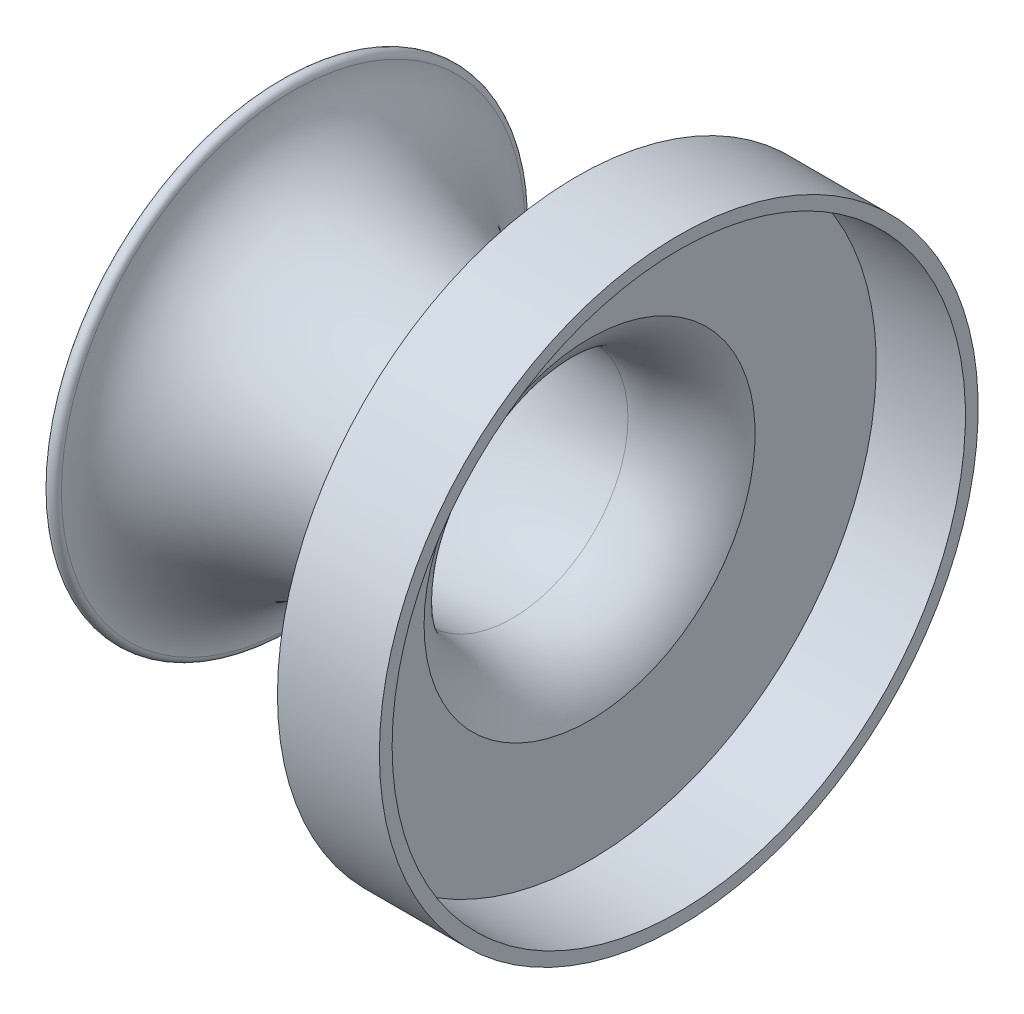
from build123d import *


with BuildPart() as part:
    # Sketch1 → Revolve1 (revolve)
    with BuildSketch(Plane.XY):
        with BuildLine():
            Line((15.446351252, 33.000061), (15.446351252, 57.15))
            Line((15.446351252, 57.15), (33.226351252, 57.15))
            Line((33.226351252, 57.15), (33.226351252, 59.69))
            Line((33.226351252, 59.69), (12.906351252, 59.69))
            Line((12.906351252, 59.69), (12.906351252, 33.579511809))
            ThreePointArc((12.906351252, 33.579511809), (7.576431779, 27.783815658), (0, 25.64003))
            add(Edge.make_bspline(
                [(-43.66006, 46.20006), (-43.66006, 45.606103818), (-43.544794528, 44.432570076), (-42.839776678, 42.039054169), (-41.001665327, 38.971251765), (-37.14971819, 35.345133748), (-31.752396376, 32.048371643), (-25.035415413, 29.287682921), (-17.281065772, 27.214070609), (-8.82958884, 25.929831174), (-2.92413983, 25.64003), (0, 25.64003)],
                knots=[3.141592654, 3.141592654, 3.141592654, 3.141592654, 3.239767424, 3.337942194, 3.534291735, 3.730641276, 3.926990817, 4.123340358, 4.319689899, 4.51603944, 4.71238898, 4.71238898, 4.71238898, 4.71238898], degree=3))
            ThreePointArc((-43.66006, 46.20006), (-44.93006, 47.47006), (-46.20006, 46.20006))
            add(Edge.make_bspline(
                [(-46.20006, 46.20006), (-46.20006, 23.10003), (0, 23.10003)],
                knots=[3.141592654, 3.141592654, 3.141592654, 4.71238898, 4.71238898, 4.71238898], degree=2, weights=[1, 0.707106781, 1]))
            ThreePointArc((0, 23.10003), (9.1733361, 25.787457832), (15.446351252, 33.000061))
        make_face()
    revolve(axis=Axis((0, 0, 0), (1, 0, 0)))


solid = part.part
